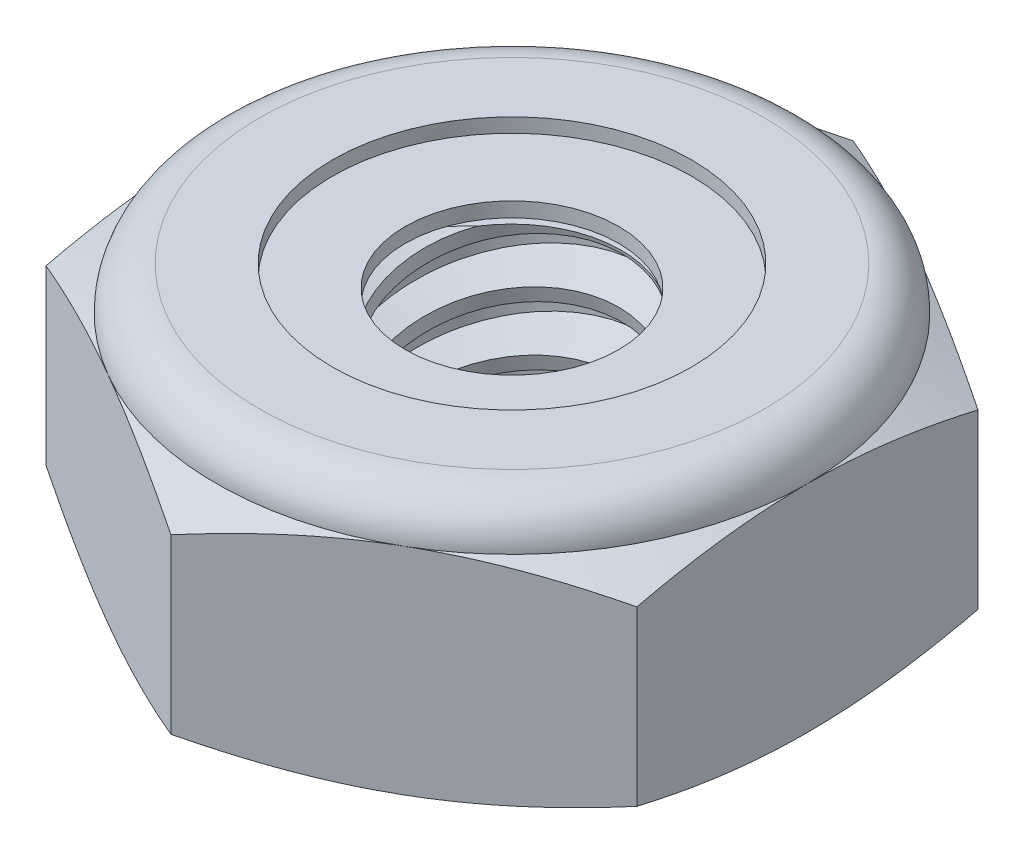
from build123d import *

# Parameters (mm, degrees)
EXTRUDE1_DEPTH       = 2.778125
SKETCH2_W            = 1.4224
SKETCH2_H            = 2.778125
LPATTERN1_COUNT      = 4
LPATTERN1_PITCH      = 0.635
LPATTERN1_COUNT_DIR2 = 2
LPATTERN1_PITCH_DIR2 = 0.635


with BuildPart() as part:
    # Sketch1 → Extrude1 (new body)
    with BuildSketch(Plane(origin=(0, 0, 0), x_dir=(1, 0, 0), z_dir=(0, 1, 0))):
        Polygon((0, 3.666174209), (-3.175, 1.833087105), (-3.175, -1.833087105), (0, -3.666174209), (3.175, -1.833087105), (3.175, 1.833087105), align=None)
    extrude(amount=EXTRUDE1_DEPTH)

    # Sketch4 → Cut-Revolve2 (revolve, cut)
    with BuildSketch(Plane(origin=(0, 0, 0), x_dir=(0, 0, -1), z_dir=(1, 0, 0))):
        Polygon((0, 2.778125), (1.4224, 2.778125), (1.147473684, 2.649924754), (1.147473684, 0.128200246), (1.4224, 0), (0, 0), align=None)
    revolve(axis=Axis((0, 2.778125, 0), (0, 1, 0)), mode=Mode.SUBTRACT)


with BuildPart() as body_2:
    # Sketch2 → Revolve1 (revolve)
    with BuildSketch(Plane(origin=(0, 0, 0), x_dir=(0, 0, -1), z_dir=(1, 0, 0))):
        with Locations((0.7112, 1.3890625)):
            Rectangle(SKETCH2_W, SKETCH2_H)
    revolve(axis=Axis((0, -1.4224, 0), (0, 1, 0)))

    # Sketch3 → Cut-Revolve1 (revolve, cut)
    with BuildSketch(Plane(origin=(0, 0, 0), x_dir=(0, 0, -1), z_dir=(1, 0, 0))):
        Polygon((1.439692084, 2.700656462), (1.560736676, 2.158376693), (1.182057853, 2.277171117), (1.147473684, 2.432108194), align=None)
    cut_revolve1 = revolve(axis=Axis((0, 2.778125, 0.152561988), (0, -0.9759815859905214, -0.21785303258716968)), mode=Mode.SUBTRACT)

    # LPattern1: Cut-Revolve1 4 × 2
    with Locations(*[Vector(0, -1, 0) * (i * LPATTERN1_PITCH) + Vector(0, 1, 0) * (j * LPATTERN1_PITCH_DIR2) for i in range(LPATTERN1_COUNT) for j in range(LPATTERN1_COUNT_DIR2) if (i, j) != (0, 0)]):
        add(cut_revolve1, mode=Mode.SUBTRACT)


with BuildPart() as part_1:
    add(part.part)

    # Combine1: cut body 2
    add(body_2.part, mode=Mode.SUBTRACT)

    # Sketch5 → Cut-Revolve3 (revolve, cut)
    with BuildSketch(Plane(origin=(0, 0, 0), x_dir=(0, 0, -1), z_dir=(1, 0, 0))):
        with BuildLine():
            Line((0, 0), (3.175, 0))
            Line((3.175, 0), (3.666174209, 0.229038295))
            Line((3.666174209, 0.229038295), (3.666174209, 2.086065871))
            Line((3.666174209, 2.086065871), (3.175, 2.315104167))
            ThreePointArc((3.175, 2.315104167), (3.039384338, 2.642509338), (2.711979167, 2.778125))
            Line((2.711979167, 2.778125), (2.711979167, 4.048125))
            Line((2.711979167, 4.048125), (4.936174209, 4.048125))
            Line((4.936174209, 4.048125), (4.936174209, -1.27))
            Line((4.936174209, -1.27), (0, -1.27))
            Line((0, -1.27), (0, 0))
        make_face()
    revolve(axis=Axis((0, 0, 0), (0, 1, 0)), mode=Mode.SUBTRACT)

    # Sketch6 → Cut-Revolve4 (revolve, cut)
    with BuildSketch(Plane(origin=(0, 0, 0), x_dir=(0, 0, -1), z_dir=(1, 0, 0))):
        with BuildLine():
            Line((0, 2.315104167), (3.0226, 2.315104167))
            ThreePointArc((3.0226, 2.315104167), (2.931621264, 2.534746264), (2.711979167, 2.625725))
            Line((2.711979167, 2.625725), (1.929726426, 2.625725))
            Line((1.929726426, 2.625725), (1.929726426, 4.048125))
            Line((1.929726426, 4.048125), (0, 4.048125))
            Line((0, 4.048125), (0, 2.315104167))
        make_face()
    revolve(axis=Axis((0, 4.048125, 0), (0, 1, 0)), mode=Mode.SUBTRACT)


with BuildPart() as body_2_2:
    # Sketch7 → Revolve2 (revolve)
    with BuildSketch(Plane(origin=(0, 0, 0), x_dir=(0, 0, -1), z_dir=(1, 0, 0))):
        with BuildLine():
            Line((1.147473684, 2.391304167), (2.933669688, 2.391304167))
            ThreePointArc((2.933669688, 2.391304167), (2.848159671, 2.505912964), (2.711979167, 2.549525))
            Line((2.711979167, 2.549525), (1.147473684, 2.549525))
            Line((1.147473684, 2.549525), (1.147473684, 2.391304167))
        make_face()
    revolve(axis=Axis((0, 2.391304167, 0), (0, 1, 0)))


solid = Compound([part_1.part, body_2_2.part])
